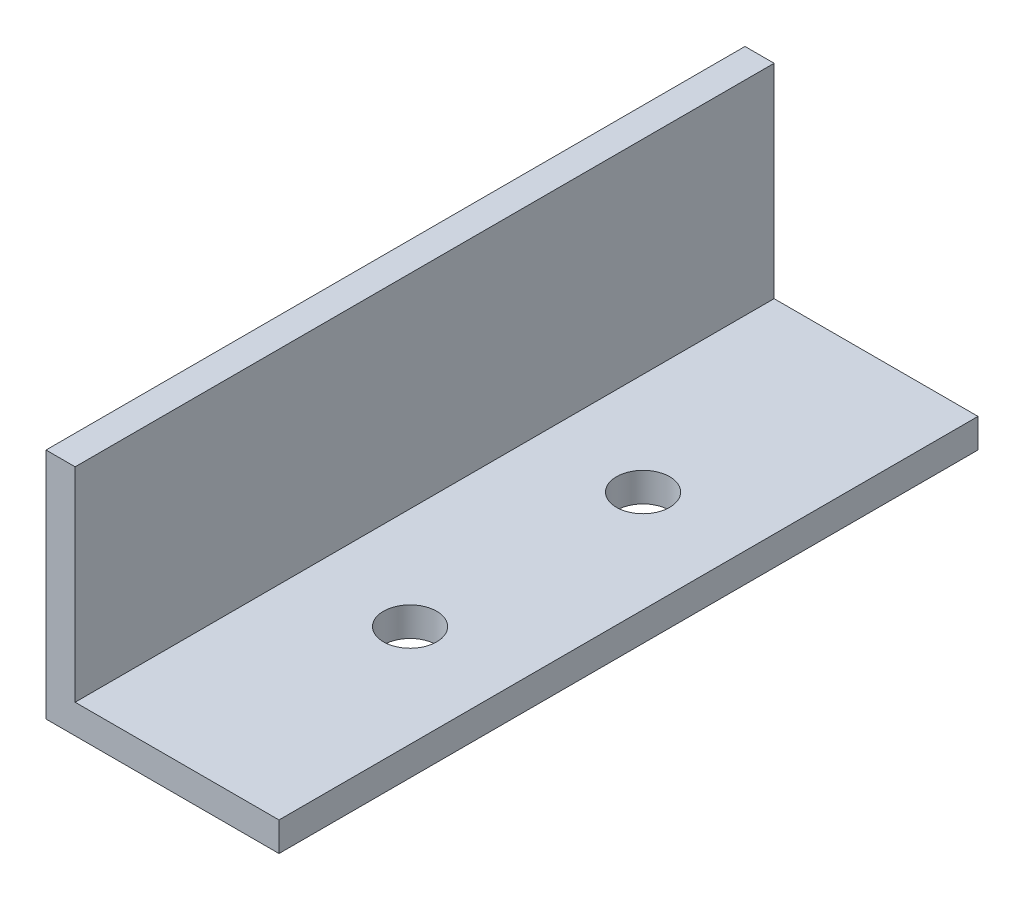
from build123d import *

# Parameters (mm, degrees)
BOSS_EXTRUDE1_DEPTH = 76.2
SKETCH2_R           = 2.9
CUT_EXTRUDE1_DEPTH  = 76.2


with BuildPart() as part:
    # Sketch1 → Boss-Extrude1 (new body)
    with BuildSketch(Plane.XY):
        Polygon((0, 0), (25.4, 0), (25.4, 3.175), (3.175, 3.175), (3.175, 25.4), (0, 25.4), align=None)
    extrude(amount=BOSS_EXTRUDE1_DEPTH)

    # Sketch2 → Cut-Extrude1 (cut)
    with BuildSketch(Plane(origin=(0, 0, 0), x_dir=(1, 0, 0), z_dir=(0, 1, 0))):
        with Locations((14.2875, -25.4)):
            Circle(SKETCH2_R)
        with Locations((14.2875, -50.8)):
            Circle(SKETCH2_R)
    extrude(amount=CUT_EXTRUDE1_DEPTH, mode=Mode.SUBTRACT)


solid = part.part
